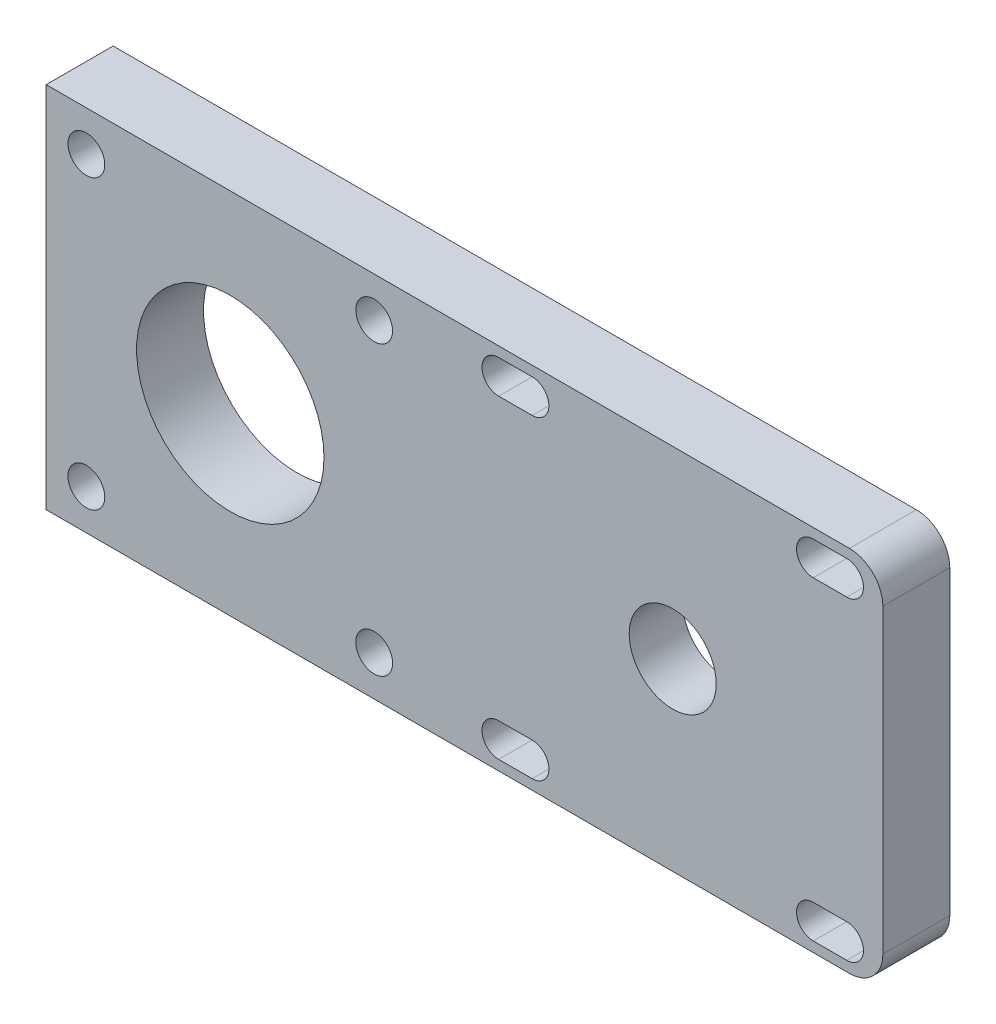
from build123d import *

# Parameters (mm, degrees)
SCHIZZO1_W                   = 125
SCHIZZO1_H                   = 55
ESTRUSIONE_ESTRUSIONE1_DEPTH = 10
SCHIZZO2_R                   = 14
SCHIZZO2_R_2                 = 2.75
TAGLIO_ESTRUSIONE1_DEPTH     = 137.930639376
RACCORDO1_R                  = 5
SCHIZZO3_R                   = 6.5
TAGLIO_ESTRUSIONE2_DEPTH     = 137.930639376
TAGLIO_ESTRUSIONE3_DEPTH     = 2


with BuildPart() as part:
    # Schizzo1 → Estrusione-Estrusione1 (new body)
    with BuildSketch(Plane.XY):
        with Locations((62.5, 27.5)):
            Rectangle(SCHIZZO1_W, SCHIZZO1_H)
    extrude(amount=-ESTRUSIONE_ESTRUSIONE1_DEPTH)

    # Schizzo2 → Taglio-Estrusione1 (cut, through all)
    with BuildSketch(Plane.XY):
        with Locations((27.5, 27.5)):
            Circle(SCHIZZO2_R)
        with Locations((6, 6)):
            Circle(SCHIZZO2_R_2)
        with Locations((49, 6)):
            Circle(SCHIZZO2_R_2)
        with Locations((49, 49)):
            Circle(SCHIZZO2_R_2)
        with Locations((6, 49)):
            Circle(SCHIZZO2_R_2)
    extrude(amount=-TAGLIO_ESTRUSIONE1_DEPTH, mode=Mode.SUBTRACT)

    # Raccordo1
    raccordo1_edges = [part.edges().sort_by_distance(p)[0] for p in [
        (125, 0, -5),
        (125, 55, -5),
    ]]
    fillet(raccordo1_edges, radius=RACCORDO1_R)

    # Schizzo3 → Taglio-Estrusione2 (cut, through all)
    with BuildSketch(Plane(origin=(0, 0, -10), x_dir=(-1, 0, 0), z_dir=(0, 0, -1))):
        with Locations((-93.6, 27.5)):
            Circle(SCHIZZO3_R)
        with BuildLine():
            Line((-119.6, 53.5), (-114.6, 53.5))
            ThreePointArc((-114.6, 53.5), (-112.1, 51), (-114.6, 48.5))
            Line((-114.6, 48.5), (-119.6, 48.5))
            ThreePointArc((-119.6, 48.5), (-122.1, 51), (-119.6, 53.5))
        make_face()
        with BuildLine():
            Line((-67.6, 53.5), (-72.6, 53.5))
            ThreePointArc((-72.6, 53.5), (-75.1, 51), (-72.6, 48.5))
            Line((-72.6, 48.5), (-67.6, 48.5))
            ThreePointArc((-67.6, 48.5), (-65.1, 51), (-67.6, 53.5))
        make_face()
        with BuildLine():
            Line((-119.6, 1.5), (-114.6, 1.5))
            ThreePointArc((-114.6, 1.5), (-112.1, 4), (-114.6, 6.5))
            Line((-114.6, 6.5), (-119.6, 6.5))
            ThreePointArc((-119.6, 6.5), (-122.1, 4), (-119.6, 1.5))
        make_face()
        with BuildLine():
            Line((-67.6, 1.5), (-72.6, 1.5))
            ThreePointArc((-72.6, 1.5), (-75.1, 4), (-72.6, 6.5))
            Line((-72.6, 6.5), (-67.6, 6.5))
            ThreePointArc((-67.6, 6.5), (-65.1, 4), (-67.6, 1.5))
        make_face()
    extrude(amount=-TAGLIO_ESTRUSIONE2_DEPTH, mode=Mode.SUBTRACT)

    # Schizzo4 → Taglio-Estrusione3 (cut)
    with BuildSketch(Plane(origin=(0, 0, -10), x_dir=(-1, 0, 0), z_dir=(0, 0, -1))):
        with BuildLine():
            Line((-73.6, 9), (-113.6, 9))
            ThreePointArc((-113.6, 9), (-117.135533906, 10.464466094), (-118.6, 14))
            Line((-118.6, 14), (-118.6, 41))
            ThreePointArc((-118.6, 41), (-117.135533906, 44.535533906), (-113.6, 46))
            Line((-113.6, 46), (-73.6, 46))
            ThreePointArc((-73.6, 46), (-70.064466094, 44.535533906), (-68.6, 41))
            Line((-68.6, 41), (-68.6, 14))
            ThreePointArc((-68.6, 14), (-70.064466094, 10.464466094), (-73.6, 9))
        make_face()
    extrude(amount=-TAGLIO_ESTRUSIONE3_DEPTH, mode=Mode.SUBTRACT)


solid = part.part
